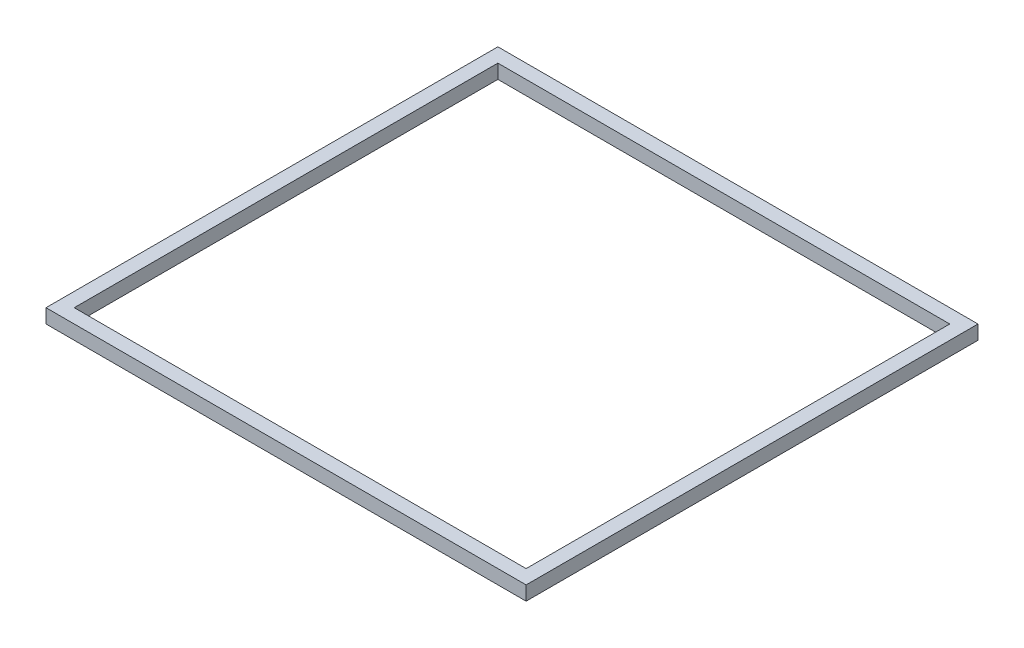
from build123d import *

# Parameters (mm, degrees)
SKETCH_1_W      = 680
SKETCH_1_H      = 640
SKETCH_1_W_2    = 640
SKETCH_1_H_2    = 600
EXTRUDE_1_DEPTH = 20


with BuildPart() as part:
    # 草图1 → 凸台-拉伸1 (new body)
    with BuildSketch(Plane(origin=(0, 0, 0), x_dir=(1, 0, 0), z_dir=(0, 1, 0))):
        with Locations((10.61212976, -172.094950635)):
            Rectangle(SKETCH_1_W, SKETCH_1_H)
        with Locations((10.61212976, -172.094950635)):
            Rectangle(SKETCH_1_W_2, SKETCH_1_H_2, mode=Mode.SUBTRACT)
    extrude(amount=EXTRUDE_1_DEPTH)


solid = part.part
